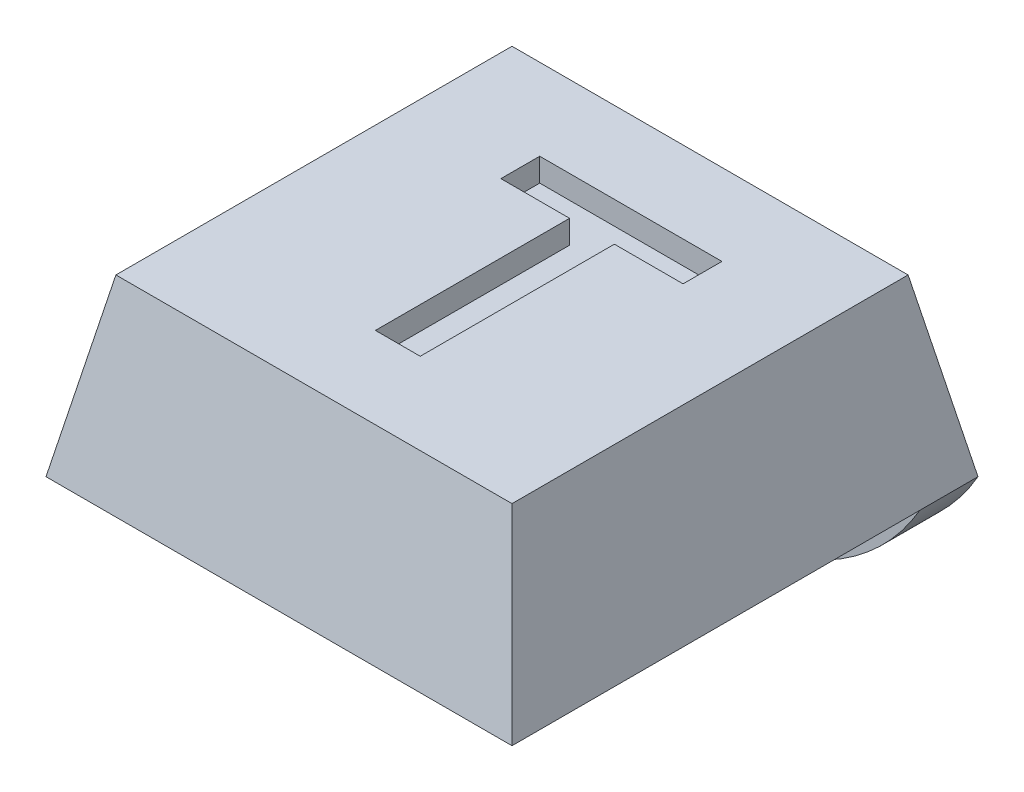
from build123d import *

# Parameters (mm, degrees)
SKETCH1_W               = 8
SKETCH1_H               = 8
BOSS_EXTRUDE1_DEPTH     = 3
CUT_EXTRUDE1_DEPTH      = 12.704699911
CUT_EXTRUDE1_DEPTH_BACK = 12.704699911
CUT_EXTRUDE2_DEPTH      = 11
SKETCH4_R               = 1.8
CUT_EXTRUDE3_DEPTH      = 0.8
SKETCH5_W               = 8
SKETCH5_H               = 1
BOSS_EXTRUDE2_DEPTH     = 2
FILLET1_R               = 4
CUT_EXTRUDE4_DEPTH      = 0.4


with BuildPart() as part:
    # Sketch1 → Boss-Extrude1 (new body)
    with BuildSketch(Plane(origin=(0, 0, 0), x_dir=(1, 0, 0), z_dir=(0, 1, 0))):
        with Locations((4, 4)):
            Rectangle(SKETCH1_W, SKETCH1_H)
    extrude(amount=BOSS_EXTRUDE1_DEPTH)

    # Sketch2 → Cut-Extrude1 (cut, two sides: drawn at the far end of the back side and taken through both)
    with BuildSketch(Plane.XY.offset(-CUT_EXTRUDE1_DEPTH_BACK)):
        Polygon((0, 0), (0.6, 3), (0, 3), align=None)
        Polygon((8, 0), (7.4, 3), (8, 3), align=None)
    extrude(amount=CUT_EXTRUDE1_DEPTH + CUT_EXTRUDE1_DEPTH_BACK, mode=Mode.SUBTRACT)

    # Sketch3 → Cut-Extrude2 (cut)
    with BuildSketch(Plane(origin=(0, 0, 0), x_dir=(0, 0, -1), z_dir=(1, 0, 0))):
        Polygon((0, 0), (0.6, 3), (0, 3), align=None)
        Polygon((8, 3), (7.4, 3), (8, 0), align=None)
    extrude(amount=CUT_EXTRUDE2_DEPTH, mode=Mode.SUBTRACT)

    # Sketch4 → Cut-Extrude3 (cut)
    with BuildSketch(Plane.XZ):
        with Locations(Location((4, -3.75, 0), (0, 0, 270))):
            Circle(SKETCH4_R)
    extrude(amount=-CUT_EXTRUDE3_DEPTH, mode=Mode.SUBTRACT)

    # Sketch5 → Boss-Extrude2 (add)
    with BuildSketch(Plane.XZ):
        with Locations((4, -7.5)):
            Rectangle(SKETCH5_W, SKETCH5_H)
    extrude(amount=BOSS_EXTRUDE2_DEPTH)

    # Fillet1
    # the kernel refuses this fillet: 4 mm, written as the material it takes off along each edge
    with BuildSketch(Plane(origin=(8, -2, -16.660254038), x_dir=(0, 1, 0), z_dir=(0, 0, 1)), Plane(origin=(0, -2, 1.660254038), x_dir=(0, 1, 0), z_dir=(0, 0, -1))) as fillet1_piece_1:
        with BuildLine():
            CenterArc((4, 3.464101615), FILLET1_R, 180, 60)
            Line((0, 3.464101615), (-0.08, 3.464101615))
            Line((-0.08, 3.464101615), (-0.08, 0))
            Line((-0.08, 0), (0, -0.08))
            ThreePointArc((0, -0.08), (1, -0.08), (1.96, -0.069282032))
            Line((1.96, -0.069282032), (2, 0))
        make_face()
    extrude(amount=18.320508076, mode=Mode.SUBTRACT)

    # Sketch6 → Cut-Extrude4 (cut)
    with BuildSketch(Plane(origin=(0, 3, 0), x_dir=(1, 0, 0), z_dir=(0, 1, 0))):
        Polygon((3.652362984, 2.002856352), (3.652362984, 5.336189685), (2.472875805, 5.336189685), (2.472875805, 6.002856352), (5.601080933, 6.002856352), (5.601080933, 5.336189685), (4.421593754, 5.336189685), (4.421593754, 2.002856352), align=None)
    extrude(amount=-CUT_EXTRUDE4_DEPTH, mode=Mode.SUBTRACT)


solid = part.part
